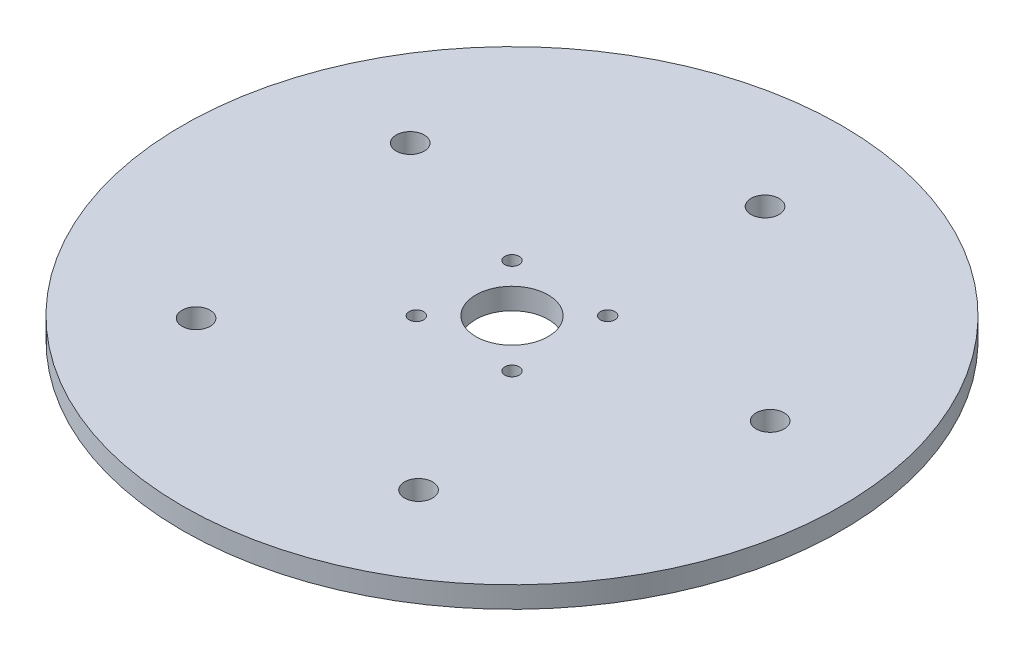
from build123d import *

# Parameters (mm, degrees)
SKETCH1_R            = 77.5
SKETCH1_R_2          = 8.5
BODY_DEPTH           = 5
M6_CLEARANCE_HOLE1_D = 6.6
M3_CLEARANCE_HOLE1_D = 3.4


with BuildPart() as part:
    # Sketch1 → Body (new body)
    with BuildSketch(Plane(origin=(0, 0, 0), x_dir=(1, 0, 0), z_dir=(0, 1, 0))):
        Circle(SKETCH1_R)
        Circle(SKETCH1_R_2, mode=Mode.SUBTRACT)
    extrude(amount=BODY_DEPTH)

    # M6 Clearance Hole1 (through all)
    with Locations(Plane(origin=(0, 5, 0), x_dir=(1, 0, 0), z_dir=(0, 1, 0))):
        with Locations((7.5, 52), (51.772566305, 8.935959835), (24.497205661, -46.4772731), (-36.632460577, -37.660494315), (-47.13731139, 23.20180758), (0, 0)):
            Hole(M6_CLEARANCE_HOLE1_D / 2)

    # M3 Clearance Hole1 (through all)
    with Locations(Plane(origin=(0, 5, 0), x_dir=(1, 0, 0), z_dir=(0, 1, 0))):
        with Locations((0, 0), (-11.25, 11.25), (11.25, -11.25), (11.25, 11.25), (-11.25, -11.25)):
            Hole(M3_CLEARANCE_HOLE1_D / 2)


solid = part.part
